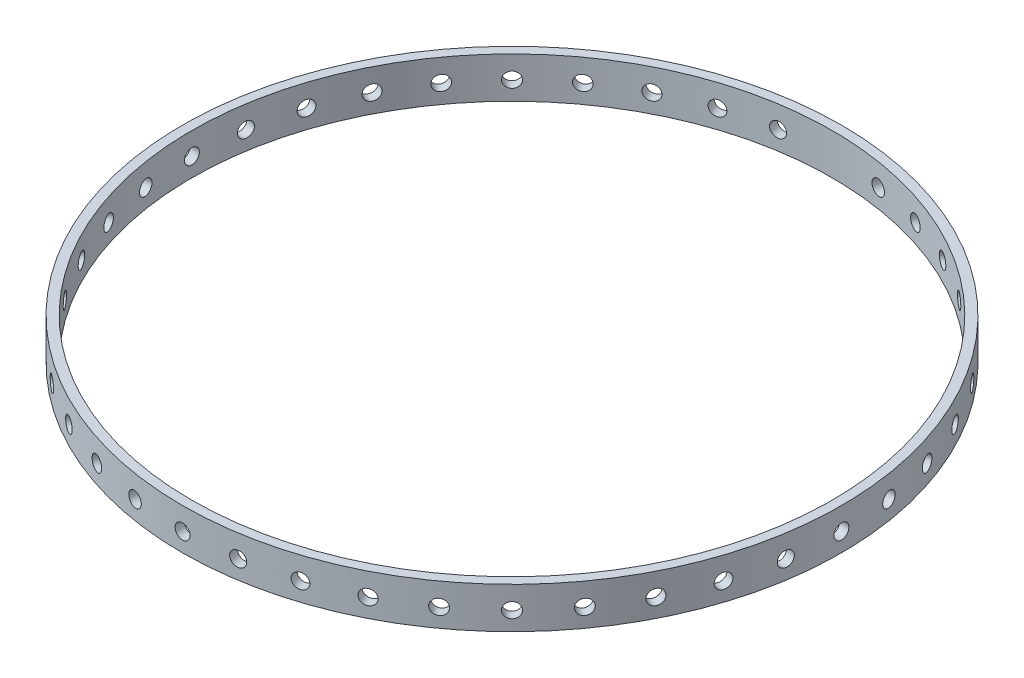
from build123d import *

# Parameters (mm, degrees)
SKETCH1_R           = 88.365
SKETCH1_R_2         = 85.865
BOSS_EXTRUDE1_DEPTH = 11
SKETCH2_R           = 2
CUT_EXTRUDE1_DEPTH  = 500
CIRPATTERN9_COUNT   = 40


with BuildPart() as part:
    # Sketch1 → Boss-Extrude1 (new body)
    with BuildSketch(Plane(origin=(0, 0, 0), x_dir=(1, 0, 0), z_dir=(0, 1, 0))):
        Circle(SKETCH1_R)
        Circle(SKETCH1_R_2, mode=Mode.SUBTRACT)
    boss_extrude1 = extrude(amount=BOSS_EXTRUDE1_DEPTH)

    # Sketch2 → Cut-Extrude1 (cut)
    with BuildSketch(Plane.XY):
        with Locations((0, 5)):
            Circle(SKETCH2_R)
    cut_extrude1 = extrude(amount=-CUT_EXTRUDE1_DEPTH, mode=Mode.SUBTRACT)

    # CirPattern9: Boss-Extrude1, Cut-Extrude1 ×40 about axis
    cirpattern9_axis = Axis((0, 11, 0), (0, 1, 0))
    add([boss_extrude1.rotate(cirpattern9_axis, i * 360 / CIRPATTERN9_COUNT) for i in range(1, CIRPATTERN9_COUNT)])
    add([cut_extrude1.rotate(cirpattern9_axis, i * 360 / CIRPATTERN9_COUNT) for i in range(1, CIRPATTERN9_COUNT)], mode=Mode.SUBTRACT)


solid = part.part
